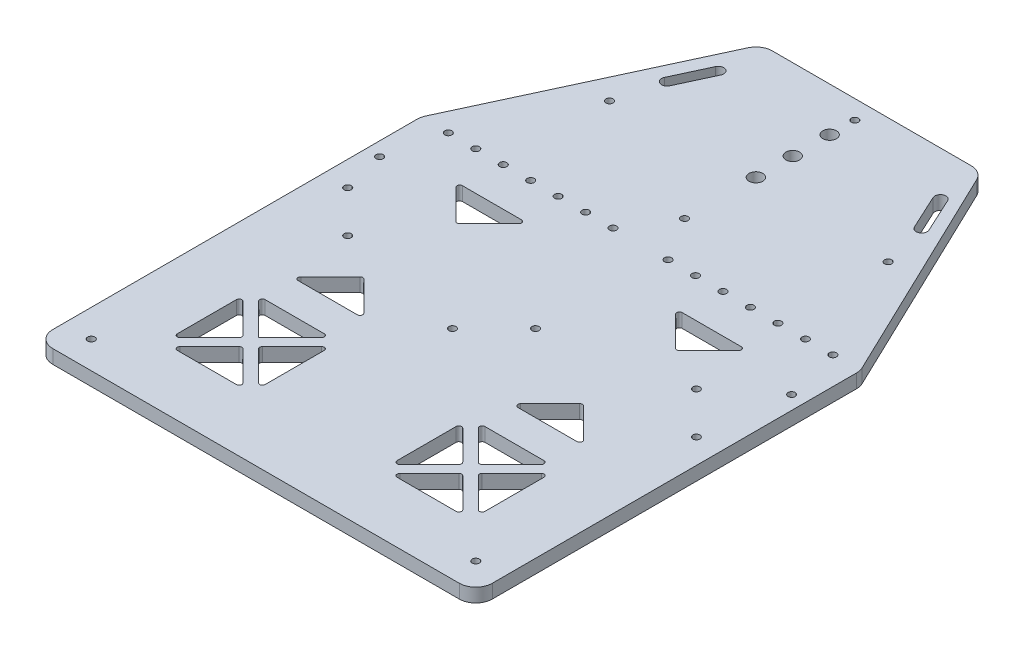
from build123d import *

# Parameters (mm, degrees)
SKETCH1_R           = 1.651
SKETCH1_R_2         = 3.175
BOSS_EXTRUDE1_DEPTH = 6.35
FILLET1_R           = 7.62
FILLET2_R           = 1.27
FILLET3_R           = 1.27
FILLET6_R           = 1.27


with BuildPart() as part:
    # Sketch1 → Boss-Extrude1 (new body)
    with BuildSketch(Plane(origin=(0, 0, 0), x_dir=(1, 0, 0), z_dir=(0, 1, 0))):
        Polygon((53.320889179, 64.921903191), (-48.279110821, 64.921903191), (-98.203039514, -42.809422492), (-98.203039514, -220.609422492), (104.996960486, -220.609422492), (104.996960486, -42.809422492), align=None)
        with Locations((-85.503039514, -207.909422492)):
            Circle(SKETCH1_R, mode=Mode.SUBTRACT)
        Polygon((-30.675141962, -192.56217671), (-64.130937065, -192.56217671), (-47.403039514, -175.834279158), align=None, mode=Mode.SUBTRACT)
        Polygon((-67.723039514, -188.970074261), (-67.723039514, -155.514279158), (-50.995141962, -172.24217671), align=None, mode=Mode.SUBTRACT)
        Polygon((-47.403039514, -168.650074261), (-64.130937065, -151.92217671), (-30.675141962, -151.92217671), align=None, mode=Mode.SUBTRACT)
        Polygon((-43.810937065, -172.24217671), (-27.083039514, -155.514279158), (-27.083039514, -188.970074261), align=None, mode=Mode.SUBTRACT)
        Polygon((-64.130937065, -136.68217671), (-47.403039514, -119.954279158), (-30.675141962, -136.68217671), align=None, mode=Mode.SUBTRACT)
        with Locations((-86.803039514, -88.029422492)):
            Circle(SKETCH1_R, mode=Mode.SUBTRACT)
        with Locations((-67.603039514, -107.229422492)):
            Circle(SKETCH1_R, mode=Mode.SUBTRACT)
        with Locations((-6.203039514, -120.229422492)):
            Circle(SKETCH1_R, mode=Mode.SUBTRACT)
        Polygon((33.876960486, -155.514279158), (50.604858038, -172.24217671), (33.876960486, -188.970074261), align=None, mode=Mode.SUBTRACT)
        Polygon((70.924858038, -151.92217671), (54.196960486, -168.650074261), (37.469062935, -151.92217671), align=None, mode=Mode.SUBTRACT)
        with Locations((92.296960486, -207.909422492)):
            Circle(SKETCH1_R, mode=Mode.SUBTRACT)
        Polygon((37.469062935, -192.56217671), (54.196960486, -175.834279158), (70.924858038, -192.56217671), align=None, mode=Mode.SUBTRACT)
        Polygon((74.516960486, -155.514279158), (74.516960486, -188.970074261), (57.789062935, -172.24217671), align=None, mode=Mode.SUBTRACT)
        Polygon((54.196960486, -119.954279158), (70.924858038, -136.68217671), (37.469062935, -136.68217671), align=None, mode=Mode.SUBTRACT)
        with Locations((12.996960486, -101.029422492)):
            Circle(SKETCH1_R, mode=Mode.SUBTRACT)
        with Locations((74.396960486, -88.029422492)):
            Circle(SKETCH1_R, mode=Mode.SUBTRACT)
        with Locations((93.596960486, -107.229422492)):
            Circle(SKETCH1_R, mode=Mode.SUBTRACT)
        with Locations((-91.853039514, -68.209422492)):
            Circle(SKETCH1_R, mode=Mode.SUBTRACT)
        with Locations((-85.503039514, -42.809422492)):
            Circle(SKETCH1_R, mode=Mode.SUBTRACT)
        with Locations((-72.803039514, -42.809422492)):
            Circle(SKETCH1_R, mode=Mode.SUBTRACT)
        Polygon((-30.675141962, -60.696668275), (-47.403039514, -77.424565827), (-64.130937065, -60.696668275), align=None, mode=Mode.SUBTRACT)
        with Locations((-60.103039514, -42.809422492)):
            Circle(SKETCH1_R, mode=Mode.SUBTRACT)
        with Locations((-47.403039514, -42.809422492)):
            Circle(SKETCH1_R, mode=Mode.SUBTRACT)
        with Locations((-34.703039514, -42.809422492)):
            Circle(SKETCH1_R, mode=Mode.SUBTRACT)
        with Locations((-22.003039514, -42.809422492)):
            Circle(SKETCH1_R, mode=Mode.SUBTRACT)
        with Locations((-9.303039514, -42.829031641)):
            Circle(SKETCH1_R, mode=Mode.SUBTRACT)
        with Locations((3.396960486, -22.489422492)):
            Circle(SKETCH1_R, mode=Mode.SUBTRACT)
        with Locations((-61.017463384, 7.228577508)):
            Circle(SKETCH1_R, mode=Mode.SUBTRACT)
        with BuildLine():
            ThreePointArc((-50.275859149, 45.510544665), (-46.903322489, 46.747151503), (-45.666715651, 43.374614842))
            Line((-45.666715651, 43.374614842), (-53.14247003, 27.242612596))
            ThreePointArc((-53.14247003, 27.242612596), (-56.515006691, 26.006005758), (-57.751613529, 29.378542419))
            Line((-57.751613529, 29.378542419), (-50.275859149, 45.510544665))
        make_face(mode=Mode.SUBTRACT)
        with Locations((3.396960486, 10.495251824)):
            Circle(SKETCH1_R_2, mode=Mode.SUBTRACT)
        with Locations((3.396960486, 27.548577508)):
            Circle(SKETCH1_R_2, mode=Mode.SUBTRACT)
        with Locations((3.396960486, 44.601903191)):
            Circle(SKETCH1_R_2, mode=Mode.SUBTRACT)
        with Locations((3.396960486, 56.250577508)):
            Circle(SKETCH1_R, mode=Mode.SUBTRACT)
        with Locations((16.096960486, -42.829031641)):
            Circle(SKETCH1_R, mode=Mode.SUBTRACT)
        with Locations((28.796960486, -42.809422492)):
            Circle(SKETCH1_R, mode=Mode.SUBTRACT)
        Polygon((37.469062935, -60.696668275), (70.924858038, -60.696668275), (54.196960486, -77.424565827), align=None, mode=Mode.SUBTRACT)
        with Locations((41.496960486, -42.809422492)):
            Circle(SKETCH1_R, mode=Mode.SUBTRACT)
        with Locations((54.196960486, -42.809422492)):
            Circle(SKETCH1_R, mode=Mode.SUBTRACT)
        with Locations((66.896960486, -42.809422492)):
            Circle(SKETCH1_R, mode=Mode.SUBTRACT)
        with Locations((79.596960486, -42.809422492)):
            Circle(SKETCH1_R, mode=Mode.SUBTRACT)
        with Locations((98.646960486, -68.209422492)):
            Circle(SKETCH1_R, mode=Mode.SUBTRACT)
        with Locations((92.296960486, -42.809422492)):
            Circle(SKETCH1_R, mode=Mode.SUBTRACT)
        with Locations((67.811384356, 7.228577508)):
            Circle(SKETCH1_R, mode=Mode.SUBTRACT)
        with BuildLine():
            Line((59.936391003, 27.242612596), (52.460636623, 43.374614842))
            ThreePointArc((52.460636623, 43.374614842), (53.697243461, 46.747151503), (57.069780122, 45.510544665))
            Line((57.069780122, 45.510544665), (64.545534501, 29.378542419))
            ThreePointArc((64.545534501, 29.378542419), (63.308927663, 26.006005758), (59.936391003, 27.242612596))
        make_face(mode=Mode.SUBTRACT)
    extrude(amount=BOSS_EXTRUDE1_DEPTH)

    # Fillet1
    fillet1_edges = [part.edges().sort_by_distance(p)[0] for p in [
        (-48.279110821, 3.175, -64.921903191),
        (53.320889179, 3.175, -64.921903191),
        (104.996960486, 3.175, 42.809422492),
        (104.996960486, 3.175, 220.609422492),
        (-98.203039514, 3.175, 220.609422492),
        (-98.203039514, 3.175, 42.809422492),
    ]]
    fillet(fillet1_edges, radius=FILLET1_R)

    # Fillet2
    fillet2_edges = [part.edges().sort_by_distance(p)[0] for p in [
        (-64.130937065, 3.175, 151.92217671),
        (-67.723039514, 3.175, 155.514279158),
        (-27.083039514, 3.175, 155.514279158),
        (-27.083039514, 3.175, 188.970074261),
        (-47.403039514, 3.175, 175.834279158),
        (-30.675141962, 3.175, 192.56217671),
        (-64.130937065, 3.175, 192.56217671),
        (-43.810937065, 3.175, 172.24217671),
        (-30.675141962, 3.175, 151.92217671),
        (-67.723039514, 3.175, 188.970074261),
        (-50.995141962, 3.175, 172.24217671),
    ]]
    fillet(fillet2_edges, radius=FILLET2_R)

    # Fillet3
    fillet3_edges = [part.edges().sort_by_distance(p)[0] for p in [
        (74.516960486, 3.175, 188.970074261),
        (74.516960486, 3.175, 155.514279158),
        (57.789062935, 3.175, 172.24217671),
        (70.924858038, 3.175, 192.56217671),
        (37.469062935, 3.175, 192.56217671),
        (54.196960486, 3.175, 175.834279158),
        (33.876960486, 3.175, 188.970074261),
        (33.876960486, 3.175, 155.514279158),
        (50.604858038, 3.175, 172.24217671),
        (70.924858038, 3.175, 151.92217671),
        (54.196960486, 3.175, 168.650074261),
        (37.469062935, 3.175, 151.92217671),
    ]]
    fillet(fillet3_edges, radius=FILLET3_R)

    # Fillet6
    fillet6_edges = [part.edges().sort_by_distance(p)[0] for p in [
        (-30.675141962, 3.175, 136.68217671),
        (70.924858038, 3.175, 60.696668275),
        (37.469062935, 3.175, 60.696668275),
        (54.196960486, 3.175, 77.424565827),
        (54.196960486, 3.175, 119.954279158),
        (37.469062935, 3.175, 136.68217671),
        (70.924858038, 3.175, 136.68217671),
        (-64.130937065, 3.175, 136.68217671),
        (-47.403039514, 3.175, 119.954279158),
        (-47.403039514, 3.175, 77.424565827),
        (-64.130937065, 3.175, 60.696668275),
        (-30.675141962, 3.175, 60.696668275),
    ]]
    fillet(fillet6_edges, radius=FILLET6_R)


solid = part.part
